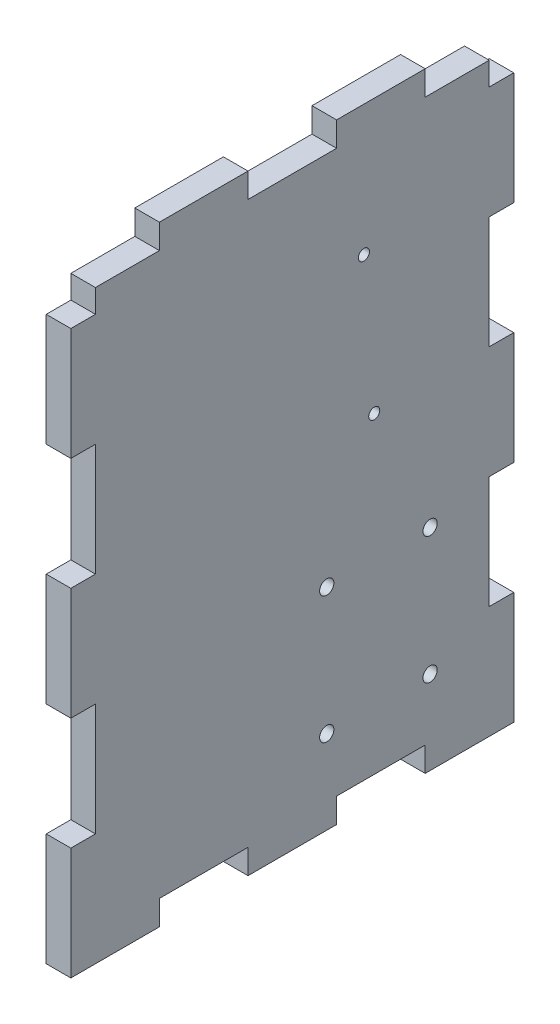
from build123d import *

# Parameters (mm, degrees)
SKETCH1_W           = 114.3
SKETCH1_H           = 203.2
BOSS_EXTRUDE1_DEPTH = 6.35
SKETCH3_W           = 6.35
SKETCH3_H           = 29.028571428
CUT_EXTRUDE4_DEPTH  = 117.743329574
SKETCH5_W           = 22.86
SKETCH5_H           = 6.35
CUT_EXTRUDE5_DEPTH  = 117.743329574
CUT_EXTRUDE6_DEPTH  = 117.743329574
CAVITY1_START       = -11.43
CAVITY1_OUTLINE_W   = 6.35
CAVITY1_OUTLINE_H   = 6.35
CAVITY1_DEPTH       = 22.86
CAVITY1_START_2     = -50.8
CAVITY1_2_OUTLINE_W = 6.35
CAVITY1_2_OUTLINE_H = 6.35
CAVITY1_2_DEPTH     = 16.51
CAVITY1_START_3     = 34.29
CAVITY1_3_OUTLINE_W = 6.35
CAVITY1_3_OUTLINE_H = 6.35
CAVITY1_3_DEPTH     = 16.51
SKETCH7_R           = 1.4224
CUT_EXTRUDE7_DEPTH  = 117.743329574
SKETCH8_R           = 1.8415
CUT_EXTRUDE8_DEPTH  = 117.743329574


# Read off the part's stored shape, not the designer's step: Cavity1
with BuildPart() as part:
    # Sketch1 → Boss-Extrude1 (new body)
    with BuildSketch(Plane(origin=(0, 0, 0), x_dir=(0, 0, -1), z_dir=(1, 0, 0))):
        Rectangle(SKETCH1_W, SKETCH1_H)
    extrude(amount=BOSS_EXTRUDE1_DEPTH)

    # Sketch3 → Cut-Extrude4 (cut, through all)
    with BuildSketch(Plane(origin=(6.35, 0, 0), x_dir=(0, 0, -1), z_dir=(1, 0, 0))):
        with Locations((-53.975, -58.057142857)):
            Rectangle(SKETCH3_W, SKETCH3_H)
        with Locations((-53.975, 0)):
            Rectangle(SKETCH3_W, SKETCH3_H)
        with Locations((-53.975, 58.057142857)):
            Rectangle(SKETCH3_W, SKETCH3_H)
        with Locations((53.975, 58.057142857)):
            Rectangle(SKETCH3_W, SKETCH3_H)
        with Locations((53.975, 0)):
            Rectangle(SKETCH3_W, SKETCH3_H)
        with Locations((53.975, -58.057142857)):
            Rectangle(SKETCH3_W, SKETCH3_H)
    extrude(amount=-CUT_EXTRUDE4_DEPTH, mode=Mode.SUBTRACT)

    # Sketch5 → Cut-Extrude5 (cut, through all)
    with BuildSketch(Plane(origin=(6.35, 0, 0), x_dir=(0, 0, -1), z_dir=(1, 0, 0))):
        with Locations((-22.86, -98.425)):
            Rectangle(SKETCH5_W, SKETCH5_H)
        with Locations((22.86, -98.425)):
            Rectangle(SKETCH5_W, SKETCH5_H)
    extrude(amount=-CUT_EXTRUDE5_DEPTH, mode=Mode.SUBTRACT)

    # Sketch6 → Cut-Extrude6 (cut, through all)
    with BuildSketch(Plane(origin=(6.35, 0, 0), x_dir=(0, 0, -1), z_dir=(1, 0, 0))):
        Polygon((0, 55.88), (50.8, 55.88), (50.8, 72.571428571), (57.15, 72.571428571), (57.15, 101.6), (-57.15, 101.6), (-57.15, 72.571428571), (-50.8, 72.571428571), (-50.8, 55.88), align=None)
    extrude(amount=-CUT_EXTRUDE6_DEPTH, mode=Mode.SUBTRACT)

    # Cavity1 outline → Cavity1 (cut)
    with BuildSketch(Plane.XY.offset(CAVITY1_START)):
        with Locations((3.175, 52.705)):
            Rectangle(CAVITY1_OUTLINE_W, CAVITY1_OUTLINE_H)
    extrude(amount=CAVITY1_DEPTH, mode=Mode.SUBTRACT)

    # Cavity1 2 outline → Cavity1 2 (cut)
    with BuildSketch(Plane.XY.offset(CAVITY1_START_2)):
        with Locations((3.175, 52.705)):
            Rectangle(CAVITY1_2_OUTLINE_W, CAVITY1_2_OUTLINE_H)
    extrude(amount=CAVITY1_2_DEPTH, mode=Mode.SUBTRACT)

    # Cavity1 3 outline → Cavity1 3 (cut)
    with BuildSketch(Plane.XY.offset(CAVITY1_START_3)):
        with Locations((3.175, 52.705)):
            Rectangle(CAVITY1_3_OUTLINE_W, CAVITY1_3_OUTLINE_H)
    extrude(amount=CAVITY1_3_DEPTH, mode=Mode.SUBTRACT)

    # Sketch7 → Cut-Extrude7 (cut, through all)
    with BuildSketch(Plane(origin=(6.35, 0, 0), x_dir=(0, 0, -1), z_dir=(1, 0, 0))):
        with Locations((18.487090642, 22.207344877)):
            Circle(SKETCH7_R)
        with Locations((21.143949011, -14.574648396)):
            Circle(SKETCH7_R)
    extrude(amount=-CUT_EXTRUDE7_DEPTH, mode=Mode.SUBTRACT)

    # Sketch8 → Cut-Extrude8 (cut, through all)
    with BuildSketch(Plane.ZY):
        with Locations((-35.56, -47.244)):
            Circle(SKETCH8_R)
        with Locations((-8.89, -47.244)):
            Circle(SKETCH8_R)
        with Locations((-35.56, -80.01)):
            Circle(SKETCH8_R)
        with Locations((-8.89, -80.01)):
            Circle(SKETCH8_R)
    extrude(amount=-CUT_EXTRUDE8_DEPTH, mode=Mode.SUBTRACT)


solid = part.part
